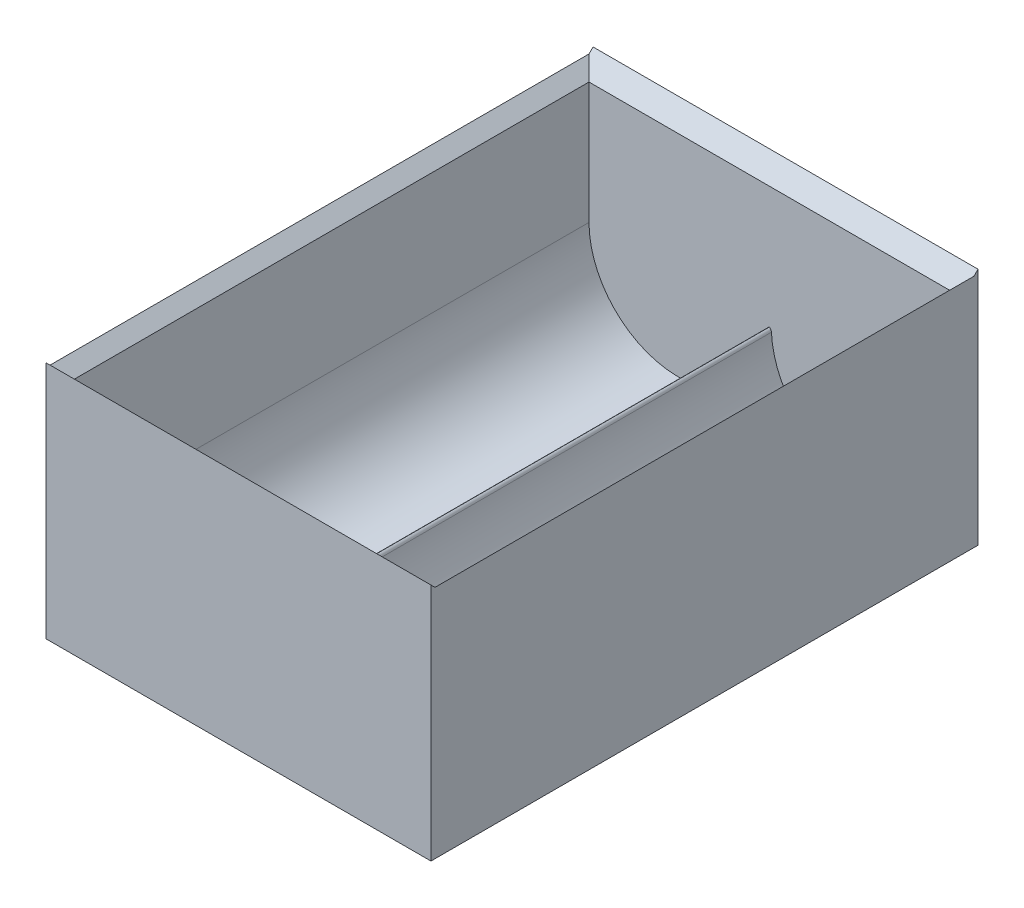
from build123d import *

# Parameters (mm, degrees)
SKETCH1_W           = 95
SKETCH1_H           = 135
BOSS_EXTRUDE1_DEPTH = 65
CUT_EXTRUDE1_DEPTH  = 127
FILLET1_R           = 1


with BuildPart() as part:
    # Sketch1 → Boss-Extrude1 (new body)
    with BuildSketch(Plane(origin=(0, 0, 0), x_dir=(1, 0, 0), z_dir=(0, 1, 0))):
        Rectangle(SKETCH1_W, SKETCH1_H)
    extrude(amount=BOSS_EXTRUDE1_DEPTH)

    # Sketch2 → Cut-Extrude1 (cut)
    with BuildSketch(Plane.XY.offset(63.5)):
        with BuildLine():
            Line((-44.5, 25), (-44.5, 70))
            Line((-44.5, 70), (44.5, 70))
            Line((44.5, 70), (44.5, 25))
            ThreePointArc((44.5, 25), (22.5, 3), (0.5, 25))
            Line((0.5, 25), (-0.5, 25))
            ThreePointArc((-0.5, 25), (-22.5, 3), (-44.5, 25))
        make_face()
    extrude(amount=-CUT_EXTRUDE1_DEPTH, mode=Mode.SUBTRACT)

    # Fillet1
    # the kernel refuses this fillet: 1 mm, written as the material it takes off along each edge
    with BuildSketch(Plane(origin=(0.5, 25, 63.5), x_dir=(-1, 0, 0), z_dir=(0, 0, -1))) as fillet1_piece_1:
        with BuildLine():
            CenterArc((0.978250586, -1), FILLET1_R, 90, 87.508093631)
            ThreePointArc((-0.020803787, -0.956521739), (-0.005201562, -0.478373974), (0, 0))
            Line((0, 0), (0.978250586, 0))
        make_face()
    extrude(amount=127, mode=Mode.SUBTRACT)
    with BuildSketch(Plane(origin=(-0.5, 25, 63.5), x_dir=(-0.02174427153342351, -0.9997635653770749, 0), z_dir=(0, 0, -1))) as fillet1_piece_2:
        with BuildLine():
            CenterArc((0.978492219, -0.999763565), FILLET1_R, 91.245953184, 87.508093631)
            Line((-0.021271346, -0.978019294), (0, 0))
            ThreePointArc((0, 0), (0.478373974, -0.005201562), (0.956747947, 0))
        make_face()
    extrude(amount=127, mode=Mode.SUBTRACT)

    # Chamfer1
    # the kernel refuses this chamfer: 10 mm, written as the material it takes off along each edge
    with BuildSketch(Plane(origin=(-44.5, 65, 63.5), x_dir=(0, 0.027495876610586317, 0.9996219169112968), z_dir=(1, 0, 0))) as chamfer1_piece_1:
        with BuildLine():
            Line((10.286731952, 0), (-0.565471549, 10.271177935))
            Line((-0.565471549, 10.271177935), (-0.765395932, 10.26567876))
            ThreePointArc((-0.765395932, 10.26567876), (-0.341292271, 5.133978296), (-0.199924383, -0.005499175))
            Line((-0.199924383, -0.005499175), (0.005499175, -0.199924383))
            ThreePointArc((0.005499175, -0.199924383), (5.144976647, -0.058556496), (10.292231127, -0.199924383))
            Line((10.292231127, -0.199924383), (10.286731952, 0))
        make_face()
    extrude(amount=89, mode=Mode.SUBTRACT)
    with BuildSketch(Plane(origin=(44.5, 65, 63.5), x_dir=(0.9996219169112968, 0.027495876610586317, 0), z_dir=(0, 0, -1)), Plane(origin=(-44.5, 65, -63.5), x_dir=(-0.9996219169112968, 0.027495876610586317, 0), z_dir=(0, 0, 1))) as chamfer1_piece_2:
        with BuildLine():
            Line((10.286731952, 0), (-0.565471549, 10.271177935))
            Line((-0.565471549, 10.271177935), (-0.765395932, 10.26567876))
            ThreePointArc((-0.765395932, 10.26567876), (-0.341292271, 5.133978296), (-0.199924383, -0.005499175))
            Line((-0.199924383, -0.005499175), (0.005499175, -0.199924383))
            ThreePointArc((0.005499175, -0.199924383), (5.144976647, -0.058556496), (10.292231127, -0.199924383))
            Line((10.292231127, -0.199924383), (10.286731952, 0))
        make_face()
    extrude(amount=127, mode=Mode.SUBTRACT)
    with BuildSketch(Plane(origin=(-44.5, 65, -63.5), x_dir=(0, 0.027495876610586317, -0.9996219169112968), z_dir=(1, 0, 0))) as chamfer1_piece_3:
        with BuildLine():
            Line((10.286731952, 0), (-0.565471549, -10.271177935))
            Line((-0.565471549, -10.271177935), (-0.765395932, -10.26567876))
            ThreePointArc((-0.765395932, -10.26567876), (-0.341292271, -5.133978296), (-0.199924383, 0.005499175))
            Line((-0.199924383, 0.005499175), (0.005499175, 0.199924383))
            ThreePointArc((0.005499175, 0.199924383), (5.144976647, 0.058556496), (10.292231127, 0.199924383))
            Line((10.292231127, 0.199924383), (10.286731952, 0))
        make_face()
    extrude(amount=89, mode=Mode.SUBTRACT)
    with BuildSketch(Plane(origin=(-70.21682988, 65, 63.5), x_dir=(0, 0.027495876610586317, 0.9996219169112968), z_dir=(1, 0, 0))) as chamfer1_piece_4a_section:
        with BuildLine():
            Line((10.286731952, 0), (-0.565471549, 10.271177935))
            Line((-0.565471549, 10.271177935), (-0.765395932, 10.26567876))
            ThreePointArc((-0.765395932, 10.26567876), (-0.341292271, 5.133978296), (-0.199924383, -0.005499175))
            Line((-0.199924383, -0.005499175), (0.005499175, -0.199924383))
            ThreePointArc((0.005499175, -0.199924383), (5.144976647, -0.058556496), (10.292231127, -0.199924383))
            Line((10.292231127, -0.199924383), (10.286731952, 0))
        make_face()
    chamfer1_piece_4a = extrude(amount=114.71682988, mode=Mode.PRIVATE)
    chamfer1_piece_4a = split(chamfer1_piece_4a, bisect_by=Plane(origin=(-44.5, 61.702063732, 66.797936268), z_dir=(-1, 0, 0)), keep=Keep.TOP, mode=Mode.PRIVATE)
    with BuildSketch(Plane(origin=(-44.5, 65, -63.5), x_dir=(-0.9996219169112968, 0.027495876610586317, 0), z_dir=(0, 0, 1))) as chamfer1_piece_4b_section:
        with BuildLine():
            Line((10.286731952, 0), (-0.565471549, 10.271177935))
            Line((-0.565471549, 10.271177935), (-0.765395932, 10.26567876))
            ThreePointArc((-0.765395932, 10.26567876), (-0.341292271, 5.133978296), (-0.199924383, -0.005499175))
            Line((-0.199924383, -0.005499175), (0.005499175, -0.199924383))
            ThreePointArc((0.005499175, -0.199924383), (5.144976647, -0.058556496), (10.292231127, -0.199924383))
            Line((10.292231127, -0.199924383), (10.286731952, 0))
        make_face()
    chamfer1_piece_4b = extrude(amount=152.71682988, mode=Mode.PRIVATE)
    chamfer1_piece_4b = split(chamfer1_piece_4b, bisect_by=Plane(origin=(-47.797936268, 61.702063732, 63.5), z_dir=(0, 0, 1)), keep=Keep.TOP, mode=Mode.PRIVATE)
    chamfer1_piece_4 = chamfer1_piece_4a & chamfer1_piece_4b
    add(chamfer1_piece_4, mode=Mode.SUBTRACT)
    with BuildSketch(Plane(origin=(44.5, 65, 89.21682988), x_dir=(0.9996219169112968, 0.027495876610586317, 0), z_dir=(0, 0, -1))) as chamfer1_piece_5a_section:
        with BuildLine():
            Line((10.286731952, 0), (-0.565471549, 10.271177935))
            Line((-0.565471549, 10.271177935), (-0.765395932, 10.26567876))
            ThreePointArc((-0.765395932, 10.26567876), (-0.341292271, 5.133978296), (-0.199924383, -0.005499175))
            Line((-0.199924383, -0.005499175), (0.005499175, -0.199924383))
            ThreePointArc((0.005499175, -0.199924383), (5.144976647, -0.058556496), (10.292231127, -0.199924383))
            Line((10.292231127, -0.199924383), (10.286731952, 0))
        make_face()
    chamfer1_piece_5a = extrude(amount=152.71682988, mode=Mode.PRIVATE)
    chamfer1_piece_5a = split(chamfer1_piece_5a, bisect_by=Plane(origin=(47.797936268, 61.702063732, 63.5), z_dir=(0, 0, 1)), keep=Keep.TOP, mode=Mode.PRIVATE)
    with BuildSketch(Plane(origin=(-44.5, 65, 63.5), x_dir=(0, 0.027495876610586317, 0.9996219169112968), z_dir=(1, 0, 0))) as chamfer1_piece_5b_section:
        with BuildLine():
            Line((10.286731952, 0), (-0.565471549, 10.271177935))
            Line((-0.565471549, 10.271177935), (-0.765395932, 10.26567876))
            ThreePointArc((-0.765395932, 10.26567876), (-0.341292271, 5.133978296), (-0.199924383, -0.005499175))
            Line((-0.199924383, -0.005499175), (0.005499175, -0.199924383))
            ThreePointArc((0.005499175, -0.199924383), (5.144976647, -0.058556496), (10.292231127, -0.199924383))
            Line((10.292231127, -0.199924383), (10.286731952, 0))
        make_face()
    chamfer1_piece_5b = extrude(amount=114.71682988, mode=Mode.PRIVATE)
    chamfer1_piece_5b = split(chamfer1_piece_5b, bisect_by=Plane(origin=(44.5, 61.702063732, 66.797936268), z_dir=(1, 0, 0)), keep=Keep.TOP, mode=Mode.PRIVATE)
    chamfer1_piece_5 = chamfer1_piece_5a & chamfer1_piece_5b
    add(chamfer1_piece_5, mode=Mode.SUBTRACT)
    with BuildSketch(Plane(origin=(-44.5, 65, -63.5), x_dir=(0, 0.027495876610586317, -0.9996219169112968), z_dir=(1, 0, 0))) as chamfer1_piece_6a_section:
        with BuildLine():
            Line((10.286731952, 0), (-0.565471549, -10.271177935))
            Line((-0.565471549, -10.271177935), (-0.765395932, -10.26567876))
            ThreePointArc((-0.765395932, -10.26567876), (-0.341292271, -5.133978296), (-0.199924383, 0.005499175))
            Line((-0.199924383, 0.005499175), (0.005499175, 0.199924383))
            ThreePointArc((0.005499175, 0.199924383), (5.144976647, 0.058556496), (10.292231127, 0.199924383))
            Line((10.292231127, 0.199924383), (10.286731952, 0))
        make_face()
    chamfer1_piece_6a = extrude(amount=114.71682988, mode=Mode.PRIVATE)
    chamfer1_piece_6a = split(chamfer1_piece_6a, bisect_by=Plane(origin=(44.5, 61.702063732, -66.797936268), z_dir=(1, 0, 0)), keep=Keep.TOP, mode=Mode.PRIVATE)
    with BuildSketch(Plane(origin=(44.5, 65, 63.5), x_dir=(0.9996219169112968, 0.027495876610586317, 0), z_dir=(0, 0, -1))) as chamfer1_piece_6b_section:
        with BuildLine():
            Line((10.286731952, 0), (-0.565471549, 10.271177935))
            Line((-0.565471549, 10.271177935), (-0.765395932, 10.26567876))
            ThreePointArc((-0.765395932, 10.26567876), (-0.341292271, 5.133978296), (-0.199924383, -0.005499175))
            Line((-0.199924383, -0.005499175), (0.005499175, -0.199924383))
            ThreePointArc((0.005499175, -0.199924383), (5.144976647, -0.058556496), (10.292231127, -0.199924383))
            Line((10.292231127, -0.199924383), (10.286731952, 0))
        make_face()
    chamfer1_piece_6b = extrude(amount=152.71682988, mode=Mode.PRIVATE)
    chamfer1_piece_6b = split(chamfer1_piece_6b, bisect_by=Plane(origin=(47.797936268, 61.702063732, -63.5), z_dir=(0, 0, -1)), keep=Keep.TOP, mode=Mode.PRIVATE)
    chamfer1_piece_6 = chamfer1_piece_6a & chamfer1_piece_6b
    add(chamfer1_piece_6, mode=Mode.SUBTRACT)
    with BuildSketch(Plane(origin=(-70.21682988, 65, -63.5), x_dir=(0, 0.027495876610586317, -0.9996219169112968), z_dir=(1, 0, 0))) as chamfer1_piece_7a_section:
        with BuildLine():
            Line((10.286731952, 0), (-0.565471549, -10.271177935))
            Line((-0.565471549, -10.271177935), (-0.765395932, -10.26567876))
            ThreePointArc((-0.765395932, -10.26567876), (-0.341292271, -5.133978296), (-0.199924383, 0.005499175))
            Line((-0.199924383, 0.005499175), (0.005499175, 0.199924383))
            ThreePointArc((0.005499175, 0.199924383), (5.144976647, 0.058556496), (10.292231127, 0.199924383))
            Line((10.292231127, 0.199924383), (10.286731952, 0))
        make_face()
    chamfer1_piece_7a = extrude(amount=114.71682988, mode=Mode.PRIVATE)
    chamfer1_piece_7a = split(chamfer1_piece_7a, bisect_by=Plane(origin=(-44.5, 61.702063732, -66.797936268), z_dir=(-1, 0, 0)), keep=Keep.TOP, mode=Mode.PRIVATE)
    with BuildSketch(Plane(origin=(-44.5, 65, -89.21682988), x_dir=(-0.9996219169112968, 0.027495876610586317, 0), z_dir=(0, 0, 1))) as chamfer1_piece_7b_section:
        with BuildLine():
            Line((10.286731952, 0), (-0.565471549, 10.271177935))
            Line((-0.565471549, 10.271177935), (-0.765395932, 10.26567876))
            ThreePointArc((-0.765395932, 10.26567876), (-0.341292271, 5.133978296), (-0.199924383, -0.005499175))
            Line((-0.199924383, -0.005499175), (0.005499175, -0.199924383))
            ThreePointArc((0.005499175, -0.199924383), (5.144976647, -0.058556496), (10.292231127, -0.199924383))
            Line((10.292231127, -0.199924383), (10.286731952, 0))
        make_face()
    chamfer1_piece_7b = extrude(amount=152.71682988, mode=Mode.PRIVATE)
    chamfer1_piece_7b = split(chamfer1_piece_7b, bisect_by=Plane(origin=(-47.797936268, 61.702063732, -63.5), z_dir=(0, 0, -1)), keep=Keep.TOP, mode=Mode.PRIVATE)
    chamfer1_piece_7 = chamfer1_piece_7a & chamfer1_piece_7b
    add(chamfer1_piece_7, mode=Mode.SUBTRACT)


solid = part.part
